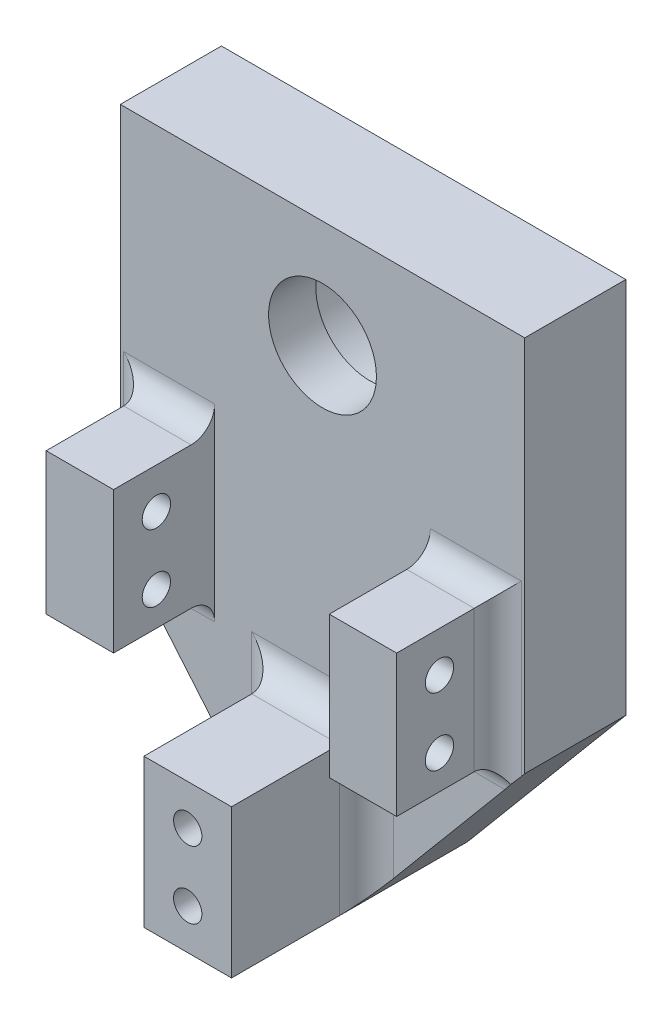
from build123d import *

# Parameters (mm, degrees)
SKETCH1_W           = 60
SKETCH1_H           = 56
SKETCH1_R           = 8
BOSS_EXTRUDE1_DEPTH = 7
SKETCH2_W           = 60
SKETCH2_H           = 56
SKETCH2_R           = 11
BOSS_EXTRUDE2_DEPTH = 8
SKETCH3_W           = 10
SKETCH3_H           = 21
BOSS_EXTRUDE3_DEPTH = 15
SKETCH4_R           = 2.1
CUT_EXTRUDE1_DEPTH  = 73.249567473
SKETCH5_R           = 2.1
BOSS_EXTRUDE4_DEPTH = 15
FILLET2_R           = 3.5
BOSS_EXTRUDE5_START = 20
SKETCH7_W           = 13
SKETCH7_H           = 22
SKETCH7_R           = 2.1
BOSS_EXTRUDE5_DEPTH = 20
FILLET3_R           = 4


with BuildPart() as part:
    # Sketch1 → Boss-Extrude1 (new body)
    with BuildSketch(Plane.XY):
        with Locations((0, -12)):
            Rectangle(SKETCH1_W, SKETCH1_H)
        Circle(SKETCH1_R, mode=Mode.SUBTRACT)
    extrude(amount=BOSS_EXTRUDE1_DEPTH)

    # Sketch2 → Boss-Extrude2 (add)
    with BuildSketch(Plane(origin=(0, 0, 0), x_dir=(-1, 0, 0), z_dir=(0, 0, -1))):
        with Locations((0, -12)):
            Rectangle(SKETCH2_W, SKETCH2_H)
        Circle(SKETCH2_R, mode=Mode.SUBTRACT)
    extrude(amount=BOSS_EXTRUDE2_DEPTH)

    # Sketch3 → Boss-Extrude3 (add)
    with BuildSketch(Plane.XY.offset(7)):
        with Locations((-21, -29.5)):
            Rectangle(SKETCH3_W, SKETCH3_H)
        with Locations((21, -29.5)):
            Rectangle(SKETCH3_W, SKETCH3_H)
    extrude(amount=BOSS_EXTRUDE3_DEPTH)

    # Sketch4 → Cut-Extrude1 (cut, through all)
    with BuildSketch(Plane.ZY.offset(26)):
        with Locations((15.65, -25)):
            Circle(SKETCH4_R)
        with Locations((15.65, -35)):
            Circle(SKETCH4_R)
    extrude(amount=-CUT_EXTRUDE1_DEPTH, mode=Mode.SUBTRACT)

    # Sketch5 → Boss-Extrude4 (add, through all)
    with BuildSketch(Plane.XY.offset(7)):
        Polygon((-30, -40), (30, -40), (6.5, -68), (-6.5, -68), align=None)
        with Locations((0, -52)):
            Circle(SKETCH5_R, mode=Mode.SUBTRACT)
        with Locations((0, -62)):
            Circle(SKETCH5_R, mode=Mode.SUBTRACT)
    extrude(amount=-BOSS_EXTRUDE4_DEPTH)

    # Fillet2
    # the kernel refuses this fillet: 3.5 mm, written as the material it adds along each edge
    with BuildSketch(Plane(origin=(-26, -19, 7), x_dir=(0, 1, 0), z_dir=(1, 0, 0)), Plane(origin=(-26, -40, 7), x_dir=(0, 0, 1), z_dir=(1, 0, 0))) as fillet2_piece_1:
        with BuildLine():
            CenterArc((FILLET2_R, FILLET2_R), FILLET2_R, 180, 90)
            Line((0, FILLET2_R), (0, 0))
            Line((0, 0), (FILLET2_R, 0))
        make_face()
    extrude(amount=10)
    with BuildSketch(Plane(origin=(-26, -40, 7), x_dir=(-1, 0, 0), z_dir=(0, 1, 0))) as fillet2_piece_2:
        with BuildLine():
            CenterArc((FILLET2_R, FILLET2_R), FILLET2_R, 180, 90)
            Line((0, FILLET2_R), (0, 0))
            Line((0, 0), (FILLET2_R, 0))
        make_face()
    extrude(amount=21)
    with BuildSketch(Plane(origin=(26, -19, 7), x_dir=(0, 1, 0), z_dir=(-1, 0, 0)), Plane(origin=(16, -40, 7), x_dir=(0, -1, 0), z_dir=(1, 0, 0))) as fillet2_piece_3:
        with BuildLine():
            CenterArc((FILLET2_R, -FILLET2_R), FILLET2_R, 90, 90)
            Line((0, -FILLET2_R), (0, 0))
            Line((0, 0), (FILLET2_R, 0))
        make_face()
    extrude(amount=10)
    with BuildSketch(Plane(origin=(26, -40, 7), x_dir=(1, 0, 0), z_dir=(0, 1, 0))) as fillet2_piece_4:
        with BuildLine():
            CenterArc((FILLET2_R, -FILLET2_R), FILLET2_R, 90, 90)
            Line((0, -FILLET2_R), (0, 0))
            Line((0, 0), (FILLET2_R, 0))
        make_face()
    extrude(amount=21)
    with BuildSketch(Plane(origin=(-34.75, -19, 7), x_dir=(0, 1, 0), z_dir=(1, 0, 0))) as fillet2_piece_5a_section:
        with BuildLine():
            CenterArc((FILLET2_R, FILLET2_R), FILLET2_R, 180, 90)
            Line((0, FILLET2_R), (0, 0))
            Line((0, 0), (FILLET2_R, 0))
        make_face()
    fillet2_piece_5a = extrude(amount=18.75, mode=Mode.PRIVATE)
    fillet2_piece_5a = split(fillet2_piece_5a, bisect_by=Plane(origin=(-30, -18.2076171, 7.7923829), z_dir=(1, 0, 0)), keep=Keep.TOP, mode=Mode.PRIVATE)
    fillet2_piece_5a = split(fillet2_piece_5a, bisect_by=Plane(origin=(-26, -18.2076171, 7.7923829), z_dir=(-1, 0, 0)), keep=Keep.TOP, mode=Mode.PRIVATE)
    with BuildSketch(Plane(origin=(-26, -40, 7), x_dir=(-1, 0, 0), z_dir=(0, 1, 0))) as fillet2_piece_5b_section:
        with BuildLine():
            CenterArc((FILLET2_R, FILLET2_R), FILLET2_R, 180, 90)
            Line((0, FILLET2_R), (0, 0))
            Line((0, 0), (FILLET2_R, 0))
        make_face()
    fillet2_piece_5b = extrude(amount=29.75, mode=Mode.PRIVATE)
    fillet2_piece_5b = split(fillet2_piece_5b, bisect_by=Plane(origin=(-26.7923829, -19, 7.7923829), z_dir=(0, 1, 0)), keep=Keep.TOP, mode=Mode.PRIVATE)
    fillet2_piece_5 = fillet2_piece_5a & fillet2_piece_5b
    add(fillet2_piece_5)
    with BuildSketch(Plane(origin=(-34.75, -40, 7), x_dir=(0, 0, 1), z_dir=(1, 0, 0))) as fillet2_piece_6a_section:
        with BuildLine():
            CenterArc((FILLET2_R, FILLET2_R), FILLET2_R, 180, 90)
            Line((0, FILLET2_R), (0, 0))
            Line((0, 0), (FILLET2_R, 0))
        make_face()
    fillet2_piece_6a = extrude(amount=18.75, mode=Mode.PRIVATE)
    fillet2_piece_6a = split(fillet2_piece_6a, bisect_by=Plane(origin=(-26, -40.649592252, 7.87643738), z_dir=(-1, 0, 0)), keep=Keep.TOP, mode=Mode.PRIVATE)
    fillet2_piece_6a = split(fillet2_piece_6a, bisect_by=Plane(origin=(-28.740316489, -41.500899502, 7.87643738), z_dir=(0.765974253829985, 0.6428712487501661, 0)), keep=Keep.TOP, mode=Mode.PRIVATE)
    fillet2_piece_6a = split(fillet2_piece_6a, bisect_by=Plane(origin=(-30, -40.649592252, 7.87643738), z_dir=(1, 0, 0)), keep=Keep.TOP, mode=Mode.PRIVATE)
    with BuildSketch(Plane(origin=(-26, -48.75, 7), x_dir=(-1, 0, 0), z_dir=(0, 1, 0))) as fillet2_piece_6b_section:
        with BuildLine():
            CenterArc((FILLET2_R, FILLET2_R), FILLET2_R, 180, 90)
            Line((0, FILLET2_R), (0, 0))
            Line((0, 0), (FILLET2_R, 0))
        make_face()
    fillet2_piece_6b = extrude(amount=29.75, mode=Mode.PRIVATE)
    fillet2_piece_6b = split(fillet2_piece_6b, bisect_by=Plane(origin=(-26.614887028, -40, 7.897241021), z_dir=(0, -1, 0)), keep=Keep.TOP, mode=Mode.PRIVATE)
    fillet2_piece_6b = split(fillet2_piece_6b, bisect_by=Plane(origin=(-27.607937943, -42.850116494, 7.897241021), z_dir=(0.765974253829985, 0.6428712487501661, 0)), keep=Keep.TOP, mode=Mode.PRIVATE)
    fillet2_piece_6 = fillet2_piece_6a & fillet2_piece_6b
    add(fillet2_piece_6)
    with BuildSketch(Plane(origin=(26, -40, 7), x_dir=(1, 0, 0), z_dir=(0, 1, 0))) as fillet2_piece_7a_section:
        with BuildLine():
            CenterArc((FILLET2_R, -FILLET2_R), FILLET2_R, 90, 90)
            Line((0, -FILLET2_R), (0, 0))
            Line((0, 0), (FILLET2_R, 0))
        make_face()
    fillet2_piece_7a = extrude(amount=29.75, mode=Mode.PRIVATE)
    fillet2_piece_7a = split(fillet2_piece_7a, bisect_by=Plane(origin=(26.7923829, -19, 7.7923829), z_dir=(0, 1, 0)), keep=Keep.TOP, mode=Mode.PRIVATE)
    with BuildSketch(Plane(origin=(34.75, -19, 7), x_dir=(0, 1, 0), z_dir=(-1, 0, 0))) as fillet2_piece_7b_section:
        with BuildLine():
            CenterArc((FILLET2_R, -FILLET2_R), FILLET2_R, 90, 90)
            Line((0, -FILLET2_R), (0, 0))
            Line((0, 0), (FILLET2_R, 0))
        make_face()
    fillet2_piece_7b = extrude(amount=18.75, mode=Mode.PRIVATE)
    fillet2_piece_7b = split(fillet2_piece_7b, bisect_by=Plane(origin=(30, -18.2076171, 7.7923829), z_dir=(-1, 0, 0)), keep=Keep.TOP, mode=Mode.PRIVATE)
    fillet2_piece_7b = split(fillet2_piece_7b, bisect_by=Plane(origin=(26, -18.2076171, 7.7923829), z_dir=(1, 0, 0)), keep=Keep.TOP, mode=Mode.PRIVATE)
    fillet2_piece_7 = fillet2_piece_7a & fillet2_piece_7b
    add(fillet2_piece_7)
    with BuildSketch(Plane(origin=(16, -40, 7), x_dir=(0, -1, 0), z_dir=(1, 0, 0))) as fillet2_piece_8a_section:
        with BuildLine():
            CenterArc((FILLET2_R, -FILLET2_R), FILLET2_R, 90, 90)
            Line((0, -FILLET2_R), (0, 0))
            Line((0, 0), (FILLET2_R, 0))
        make_face()
    fillet2_piece_8a = extrude(amount=18.75, mode=Mode.PRIVATE)
    fillet2_piece_8a = split(fillet2_piece_8a, bisect_by=Plane(origin=(28.740316489, -41.500899502, 7.87643738), z_dir=(-0.7659742538299851, 0.6428712487501659, 0)), keep=Keep.TOP, mode=Mode.PRIVATE)
    fillet2_piece_8a = split(fillet2_piece_8a, bisect_by=Plane(origin=(30, -40.649592252, 7.87643738), z_dir=(-1, 0, 0)), keep=Keep.TOP, mode=Mode.PRIVATE)
    fillet2_piece_8a = split(fillet2_piece_8a, bisect_by=Plane(origin=(26, -40.649592252, 7.87643738), z_dir=(1, 0, 0)), keep=Keep.TOP, mode=Mode.PRIVATE)
    with BuildSketch(Plane(origin=(26, -48.75, 7), x_dir=(1, 0, 0), z_dir=(0, 1, 0))) as fillet2_piece_8b_section:
        with BuildLine():
            CenterArc((FILLET2_R, -FILLET2_R), FILLET2_R, 90, 90)
            Line((0, -FILLET2_R), (0, 0))
            Line((0, 0), (FILLET2_R, 0))
        make_face()
    fillet2_piece_8b = extrude(amount=29.75, mode=Mode.PRIVATE)
    fillet2_piece_8b = split(fillet2_piece_8b, bisect_by=Plane(origin=(27.607937943, -42.850116494, 7.897241021), z_dir=(-0.7659742538299851, 0.6428712487501659, 0)), keep=Keep.TOP, mode=Mode.PRIVATE)
    fillet2_piece_8b = split(fillet2_piece_8b, bisect_by=Plane(origin=(26.614887028, -40, 7.897241021), z_dir=(0, -1, 0)), keep=Keep.TOP, mode=Mode.PRIVATE)
    fillet2_piece_8 = fillet2_piece_8a & fillet2_piece_8b
    add(fillet2_piece_8)

    # Sketch7 → Boss-Extrude5 (add)
    with BuildSketch(Plane.XY.offset(7).offset(BOSS_EXTRUDE5_START)):
        with Locations((0, -57)):
            Rectangle(SKETCH7_W, SKETCH7_H)
        with Locations((0, -62)):
            Circle(SKETCH7_R, mode=Mode.SUBTRACT)
        with Locations((0, -52)):
            Circle(SKETCH7_R, mode=Mode.SUBTRACT)
    extrude(amount=-BOSS_EXTRUDE5_DEPTH)

    # Fillet3
    fillet3_edges = [part.edges().sort_by_distance(p)[0] for p in [
        (-6.5, -57, 7),
        (6.5, -57, 7),
        (0, -46, 7),
    ]]
    fillet(fillet3_edges, radius=FILLET3_R)


solid = part.part
